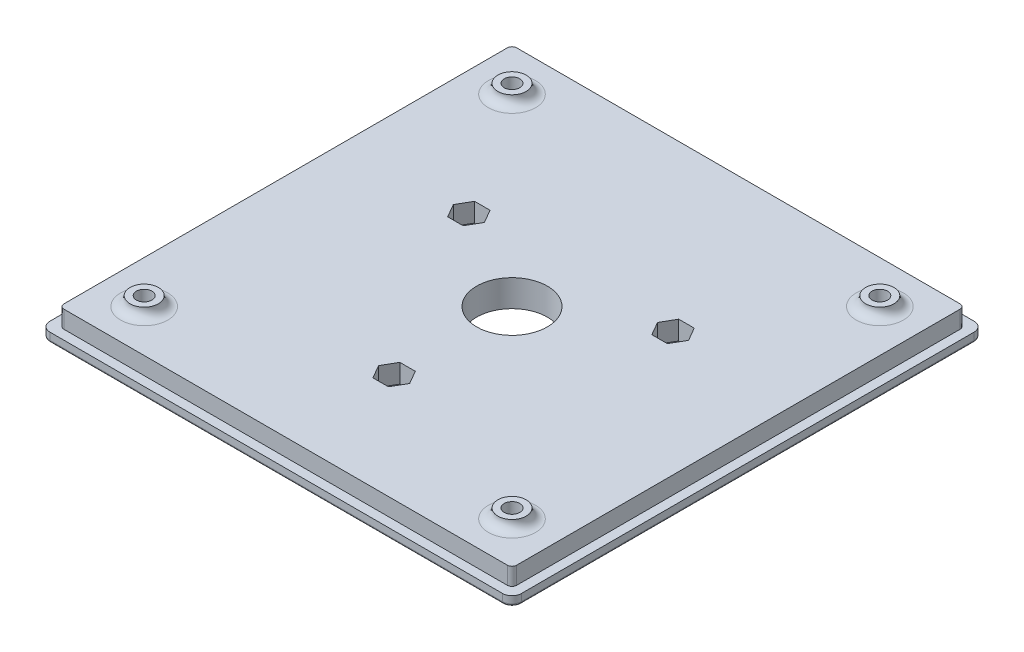
from build123d import *

# Parameters (mm, degrees)
SKETCH1_W                       = 100
SKETCH1_H                       = 100
BOSS_EXTRUDE1_DEPTH             = 2
SKETCH4_W                       = 96
SKETCH4_H                       = 96
BOSS_EXTRUDE3_DEPTH             = 3.7
SKETCH5_R                       = 1.65
CUT_EXTRUDE1_DEPTH              = 71.940045109
SKETCH6_R                       = 3
CUT_EXTRUDE2_DEPTH              = 3.5
FILETE1_R                       = 0.5
CUT_EXTRUDE3_DEPTH              = 0.6
FILLET1_R                       = 2
FILLET2_R                       = 1
BOSS_EXTRUDE7_START             = 0.3
BOSS_EXTRUDE7_DEPTH             = 0.3
LPATTERN1_COUNT                 = 2
LPATTERN1_PITCH                 = 78
LPATTERN1_COUNT_DIR2            = 2
LPATTERN1_PITCH_DIR2            = 78
LPATTERN2_COUNT                 = 2
LPATTERN2_PITCH                 = 78
LPATTERN2_COUNT_DIR2            = 2
LPATTERN2_PITCH_DIR2            = 78
SKETCH15_R                      = 3
SKETCH15_R_2                    = 1.65
BOSS_EXTRUDE8_DEPTH             = 2
LPATTERN3_COUNT                 = 2
LPATTERN3_PITCH                 = 78
LPATTERN3_COUNT_DIR2            = 2
LPATTERN3_PITCH_DIR2            = 78
FILLET3_R                       = 2
ESBO_O1_R                       = 1.65
CORTE_EXTRUS_O1_DEPTH           = 72.128686267
CORTE_EXTRUS_O3_DEPTH           = 4
ESBO_O6_R                       = 7.5
CORTE_EXTRUS_O4_DEPTH           = 71.940045179
RESSALTO_EXTRUS_O3_START        = -5.7
ESBO_O8_R                       = 1.65
RESSALTO_EXTRUS_O3_DEPTH        = 5.7
PADR_OCIRCULAR2_COUNT           = 3
PADR_OCIRCULAR2_COPY_1_SKETCH_R = 1.65
PADR_OCIRCULAR2_COPY_1_DEPTH    = 72.128686267
PADR_OCIRCULAR2_COPY_2_SKETCH_R = 1.65
PADR_OCIRCULAR2_COPY_2_DEPTH    = 72.128686267
RESSALTO_EXTRUS_O4_START        = -5.7
ESBO_O10_R                      = 1.65
RESSALTO_EXTRUS_O4_DEPTH        = 5.7
ESBO_O11_R                      = 1.8
CORTE_EXTRUS_O5_DEPTH           = 72.128686267


# Some blends are built 0.0001 mm under size
with BuildPart() as part:
    # Sketch1 → Boss-Extrude1 (new body)
    with BuildSketch(Plane(origin=(0, 0, 0), x_dir=(1, 0, 0), z_dir=(0, 1, 0))):
        Rectangle(SKETCH1_W, SKETCH1_H)
    extrude(amount=BOSS_EXTRUDE1_DEPTH)

    # Sketch4 → Boss-Extrude3 (add)
    with BuildSketch(Plane(origin=(0, 2, 0), x_dir=(1, 0, 0), z_dir=(0, 1, 0))):
        Rectangle(SKETCH4_W, SKETCH4_H)
    extrude(amount=BOSS_EXTRUDE3_DEPTH)

    # Sketch5 → Cut-Extrude1 (cut, through all)
    with BuildSketch(Plane(origin=(0, 5.7, 0), x_dir=(1, 0, 0), z_dir=(0, 1, 0))):
        with Locations(Location((-39, 39, 0), (0, 0, 270))):
            Circle(SKETCH5_R)
        with Locations(Location((39, -39, 0), (0, 0, 270))):
            Circle(SKETCH5_R)
        with Locations(Location((-39, -39, 0), (0, 0, 270))):
            Circle(SKETCH5_R)
        with Locations(Location((39, 39, 0), (0, 0, 270))):
            Circle(SKETCH5_R)
    extrude(amount=-CUT_EXTRUDE1_DEPTH, mode=Mode.SUBTRACT)

    # Sketch6 → Cut-Extrude2 (cut)
    with BuildSketch(Plane.XZ):
        with Locations(Location((39, -39, 0), (0, 0, 270))):
            Circle(SKETCH6_R)
        with Locations(Location((-39, -39, 0), (0, 0, 270))):
            Circle(SKETCH6_R)
        with Locations(Location((-39, 39, 0), (0, 0, 270))):
            Circle(SKETCH6_R)
        with Locations(Location((39, 39, 0), (0, 0, 270))):
            Circle(SKETCH6_R)
    extrude(amount=-CUT_EXTRUDE2_DEPTH, mode=Mode.SUBTRACT)

    # Filete1
    filete1_edges = [part.edges().sort_by_distance(p)[0] for p in [
        (0, 0, 50),
        (-50, 0, 0),
        (0, 0, -50),
        (50, 0, 0),
    ]]
    fillet(filete1_edges, radius=FILETE1_R)

    # Sketch7 → Cut-Extrude3 (cut)
    with BuildSketch(Plane(origin=(0, 3.5, 0), x_dir=(-1, 0, 0), z_dir=(0, -1, 0))):
        with BuildLine():
            ThreePointArc((-36.494506037, 37.35), (-36, 39), (-36.494506037, 40.65))
            Line((-36.494506037, 40.65), (-39, 40.65))
            ThreePointArc((-39, 40.65), (-37.35, 39), (-39, 37.35))
            Line((-39, 37.35), (-36.494506037, 37.35))
        make_face()
        with BuildLine():
            ThreePointArc((-39, 37.35), (-40.65, 39), (-39, 40.65))
            Line((-39, 40.65), (-41.505493963, 40.65))
            ThreePointArc((-41.505493963, 40.65), (-42, 39), (-41.505493963, 37.35))
            Line((-41.505493963, 37.35), (-39, 37.35))
        make_face()
    cut_extrude3 = extrude(amount=-CUT_EXTRUDE3_DEPTH, mode=Mode.SUBTRACT)

    # Fillet1
    # the kernel refuses this fillet: 2 mm, written as the material it takes off along each edge
    with BuildSketch(Plane(origin=(-48, 0, -48), x_dir=(-1, 0, 0), z_dir=(0, 0, 1))) as fillet1_piece_1:
        with BuildLine():
            CenterArc((1.5, -0.5), 0.5, 0, 90)
            Line((2, -0.5), (2, 0))
            Line((2, 0), (1.5, 0))
        make_face()
    revolve(axis=Axis((-48, 0, -48), (0, -1, 0)), revolution_arc=90, mode=Mode.SUBTRACT)
    with BuildSketch(Plane(origin=(48, 0, -48), x_dir=(0, 0, -1), z_dir=(-1, 0, 0))) as fillet1_piece_2:
        with BuildLine():
            CenterArc((1.5, -0.5), 0.5, 0, 90)
            Line((2, -0.5), (2, 0))
            Line((2, 0), (1.5, 0))
        make_face()
    revolve(axis=Axis((48, 0, -48), (0, -1, 0)), revolution_arc=90, mode=Mode.SUBTRACT)
    with BuildSketch(Plane(origin=(-48, 0, 48), x_dir=(0, 0, 1), z_dir=(1, 0, 0))) as fillet1_piece_3:
        with BuildLine():
            CenterArc((1.5, -0.5), 0.5, 0, 90)
            Line((2, -0.5), (2, 0))
            Line((2, 0), (1.5, 0))
        make_face()
    revolve(axis=Axis((-48, 0, 48), (0, -1, 0)), revolution_arc=90, mode=Mode.SUBTRACT)
    with BuildSketch(Plane(origin=(48, 0, 48), x_dir=(1, 0, 0), z_dir=(0, 0, -1))) as fillet1_piece_4:
        with BuildLine():
            CenterArc((1.5, -0.5), 0.5, 0, 90)
            Line((2, -0.5), (2, 0))
            Line((2, 0), (1.5, 0))
        make_face()
    revolve(axis=Axis((48, 0, 48), (0, -1, 0)), revolution_arc=90, mode=Mode.SUBTRACT)
    with BuildSketch(Plane(origin=(50, 0, 50), x_dir=(0, 0, -1), z_dir=(0, 1, 0)), Plane(origin=(-50, 0, 50), x_dir=(1, 0, 0), z_dir=(0, 1, 0)), Plane(origin=(50, 0, -50), x_dir=(-1, 0, 0), z_dir=(0, 1, 0))) as fillet1_piece_5:
        with BuildLine():
            CenterArc((FILLET1_R, FILLET1_R), FILLET1_R, 180, 90)
            Line((0, FILLET1_R), (0, 0))
            Line((0, 0), (FILLET1_R, 0))
        make_face()
    extrude(amount=7, mode=Mode.SUBTRACT)
    with BuildSketch(Plane(origin=(-50, 0, -50), x_dir=(1, 0, 0), z_dir=(0, 1, 0))) as fillet1_piece_6:
        with BuildLine():
            CenterArc((FILLET1_R, -FILLET1_R), FILLET1_R, 90, 90)
            Line((0, -FILLET1_R), (0, 0))
            Line((0, 0), (FILLET1_R, 0))
        make_face()
    extrude(amount=7, mode=Mode.SUBTRACT)

    # Fillet2
    fillet2_edges = [part.edges().sort_by_distance(p)[0] for p in [
        (48, 3.85, -48),
        (-48, 3.85, -48),
        (-48, 3.85, 48),
        (48, 3.85, 48),
    ]]
    fillet(fillet2_edges, radius=FILLET2_R)

    # Sketch14 → Boss-Extrude7 (add)
    with BuildSketch(Plane.XZ.offset(-4.1).offset(BOSS_EXTRUDE7_START)):
        with BuildLine():
            Line((40.65, -39), (40.65, -40.65))
            Line((40.65, -40.65), (41.505493963, -40.65))
            ThreePointArc((41.505493963, -40.65), (42, -39), (41.505493963, -37.35))
            Line((41.505493963, -37.35), (40.65, -37.35))
            Line((40.65, -37.35), (40.65, -39))
        make_face()
        with BuildLine():
            Line((36.494506037, -40.65), (37.35, -40.65))
            Line((37.35, -40.65), (37.35, -39))
            Line((37.35, -39), (37.35, -37.35))
            Line((37.35, -37.35), (36.494506037, -37.35))
            ThreePointArc((36.494506037, -37.35), (36, -39), (36.494506037, -40.65))
        make_face()
    boss_extrude7 = extrude(amount=-BOSS_EXTRUDE7_DEPTH)

    # LPattern1: Cut-Extrude3 2 × 2
    with Locations(*[(-i * LPATTERN1_PITCH, 0, j * LPATTERN1_PITCH_DIR2) for i in range(LPATTERN1_COUNT) for j in range(LPATTERN1_COUNT_DIR2) if (i, j) != (0, 0)]):
        add(cut_extrude3, mode=Mode.SUBTRACT)

    # LPattern2: Boss-Extrude7 2 × 2
    with Locations(*[(-i * LPATTERN2_PITCH, 0, j * LPATTERN2_PITCH_DIR2) for i in range(LPATTERN2_COUNT) for j in range(LPATTERN2_COUNT_DIR2) if (i, j) != (0, 0)]):
        add(boss_extrude7)

    # Sketch15 → Boss-Extrude8 (add)
    with BuildSketch(Plane(origin=(0, 5.7, 0), x_dir=(1, 0, 0), z_dir=(0, 1, 0))):
        with Locations(Location((39, 39, 0), (0, 0, 90))):
            Circle(SKETCH15_R)
        with Locations(Location((39, 39, 0), (0, 0, 270))):
            Circle(SKETCH15_R_2, mode=Mode.SUBTRACT)
    boss_extrude8 = extrude(amount=BOSS_EXTRUDE8_DEPTH)

    # LPattern3: Boss-Extrude8 2 × 2
    with Locations(*[(-j * LPATTERN3_PITCH_DIR2, 0, i * LPATTERN3_PITCH) for i in range(LPATTERN3_COUNT) for j in range(LPATTERN3_COUNT_DIR2) if (i, j) != (0, 0)]):
        add(boss_extrude8)

    # Fillet3
    fillet3_edges = [part.edges().sort_by_distance(p)[0] for p in [
        (39, 5.7, -36),
        (-39, 5.7, -36),
        (39, 5.7, 42),
        (-39, 5.7, 42),
    ]]
    fillet(fillet3_edges, radius=FILLET3_R - 0.0001)  # a hair under: the kernel refuses the full size

    # Esboço1 → Corte-extrusão1 (cut, through all)
    with BuildSketch(Plane.XZ):
        with Locations(Location((0, -25, 0), (0, 0, 270))):
            Circle(ESBO_O1_R)
    corte_extrus_o1 = extrude(amount=-CORTE_EXTRUS_O1_DEPTH, mode=Mode.SUBTRACT)

    # Espelhar1: Corte-extrusão1 across plane
    add(corte_extrus_o1.mirror(Plane.XY), mode=Mode.SUBTRACT)

    # Esboço2 → Corte-extrusão3 (cut)
    with BuildSketch(Plane(origin=(0, 5.7, 0), x_dir=(1, 0, 0), z_dir=(0, 1, 0))):
        Polygon((1.645448267, -27.85), (3.290896534, -25), (1.645448267, -22.15), (-1.645448267, -22.15), (-3.290896534, -25), (-1.645448267, -27.85), align=None)
    corte_extrus_o3 = extrude(amount=-CORTE_EXTRUS_O3_DEPTH, mode=Mode.SUBTRACT)

    # Esboço6 → Corte-extrusão4 (cut, through all)
    with BuildSketch(Plane(origin=(0, 5.7, 0), x_dir=(1, 0, 0), z_dir=(0, 1, 0))):
        with Locations(Location((0, 0, 0), (0, 0, 270))):
            Circle(ESBO_O6_R)
    extrude(amount=-CORTE_EXTRUS_O4_DEPTH, mode=Mode.SUBTRACT)

    # Esboço8 → Ressalto-extrusão3 (add)
    with BuildSketch(Plane(origin=(0, 5.7, 0), x_dir=(1, 0, 0), z_dir=(0, 1, 0)).offset(RESSALTO_EXTRUS_O3_START)):
        with Locations((0, 25)):
            Circle(ESBO_O8_R)
    extrude(amount=RESSALTO_EXTRUS_O3_DEPTH)

    # PadrãoCircular2: Corte-extrusão1, Corte-extrusão3 ×3 about axis
    padr_ocircular2_axis = Axis((0, 0, 0), (0, 1, 0))
    add([corte_extrus_o1.rotate(padr_ocircular2_axis, i * 360 / PADR_OCIRCULAR2_COUNT) for i in range(1, PADR_OCIRCULAR2_COUNT)], mode=Mode.SUBTRACT)
    add([corte_extrus_o3.rotate(padr_ocircular2_axis, i * 360 / PADR_OCIRCULAR2_COUNT) for i in range(1, PADR_OCIRCULAR2_COUNT)], mode=Mode.SUBTRACT)

    # PadrãoCircular2 copy 1 sketch → PadrãoCircular2 copy 1 (cut, through all)
    with BuildSketch(Plane(origin=(0, 0, 0), x_dir=(-0.4999999999999998, 0, -0.8660254037844387), z_dir=(0, -1, 0))):
        with Locations((0, 25)):
            Circle(PADR_OCIRCULAR2_COPY_1_SKETCH_R)
    extrude(amount=-PADR_OCIRCULAR2_COPY_1_DEPTH, mode=Mode.SUBTRACT)

    # PadrãoCircular2 copy 2 sketch → PadrãoCircular2 copy 2 (cut, through all)
    with BuildSketch(Plane(origin=(0, 0, 0), x_dir=(-0.5000000000000004, 0, 0.8660254037844384), z_dir=(0, -1, 0))):
        with Locations((0, 25)):
            Circle(PADR_OCIRCULAR2_COPY_2_SKETCH_R)
    extrude(amount=-PADR_OCIRCULAR2_COPY_2_DEPTH, mode=Mode.SUBTRACT)

    # Esboço10 → Ressalto-extrusão4 (add)
    with BuildSketch(Plane(origin=(0, 5.7, 0), x_dir=(1, 0, 0), z_dir=(0, 1, 0)).offset(RESSALTO_EXTRUS_O4_START)):
        with Locations((-21.650635095, -12.5)):
            Circle(ESBO_O10_R)
        with Locations((21.650635095, -12.5)):
            Circle(ESBO_O10_R)
    extrude(amount=RESSALTO_EXTRUS_O4_DEPTH)

    # Esboço11 → Corte-extrusão5 (cut, through all)
    with BuildSketch(Plane.XZ):
        with Locations(Location((21.650635095, -12.5, 0), (0, 0, 270))):
            Circle(ESBO_O11_R)
        with Locations(Location((-21.650635095, -12.5, 0), (0, 0, 270))):
            Circle(ESBO_O11_R)
        with Locations(Location((0, 25, 0), (0, 0, 270))):
            Circle(ESBO_O11_R)
    extrude(amount=-CORTE_EXTRUS_O5_DEPTH, mode=Mode.SUBTRACT)


solid = part.part
